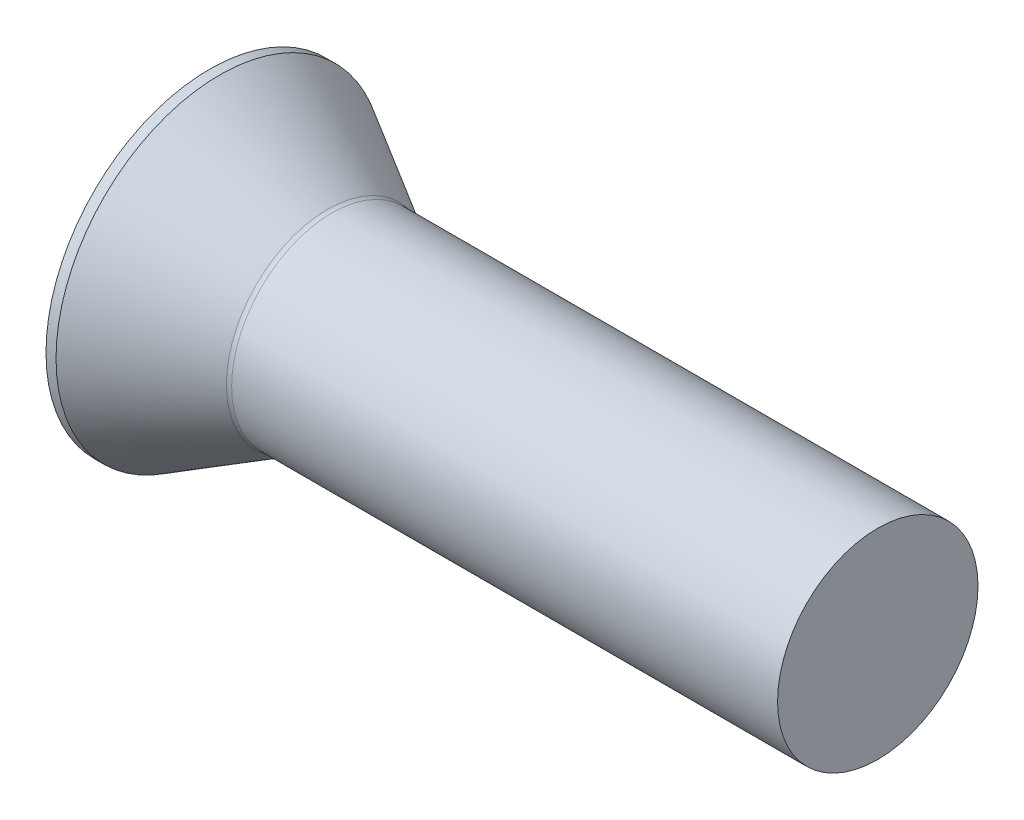
from build123d import *

# Parameters (mm, degrees)
FILLET1_R = 0.5


with BuildPart() as part:
    # Sketch1 → Base-Revolve (revolve)
    with BuildSketch(Plane(origin=(0, 0, 0), x_dir=(0, 1, 0), z_dir=(0, 0, 1))):
        Polygon((0, 0), (9.8, 0), (9.8, -0.6), (6, -7.181793069), (6, -40), (0, -40), align=None)
    revolve(axis=Axis((-2.03, 0, 0), (1, 0, 0)))

    # Fillet1
    fillet1_edges = [part.edges().sort_by_distance(p)[0] for p in [
        (7.181793069, -6, 0),
    ]]
    fillet(fillet1_edges, radius=FILLET1_R)


solid = part.part
